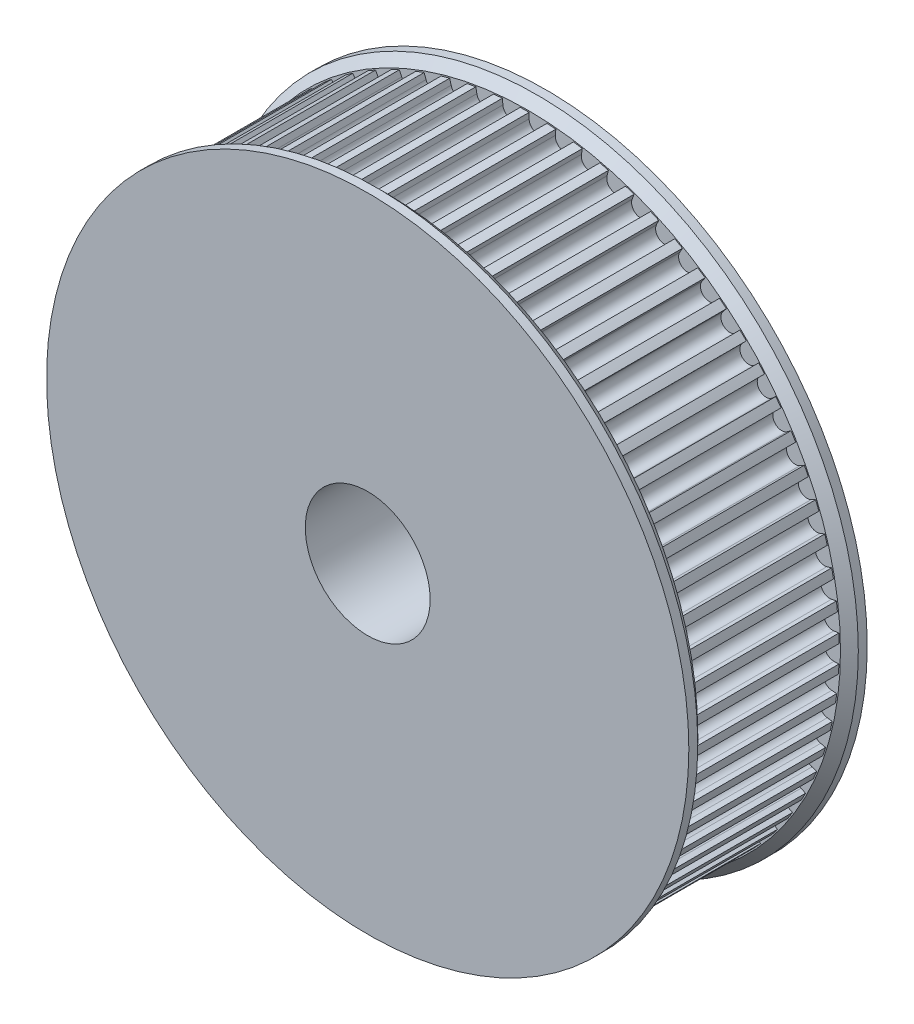
from build123d import *

# Parameters (mm, degrees)
SKETCH1_R           = 18
BOSS_EXTRUDE1_DEPTH = 20
SKETCH2_R           = 7
CUT_EXTRUDE1_DEPTH  = 60
SKETCH4_R           = 34.85
SKETCH4_R_2         = 14.576002813
BOSS_EXTRUDE2_DEPTH = 17
CUT_EXTRUDE3_DEPTH  = 18
CIRPATTERN1_COUNT   = 73
BOSS_EXTRUDE3_START = 2
SKETCH7_R           = 36
SKETCH7_R_2         = 7
BOSS_EXTRUDE3_DEPTH = 2
LPATTERN1_COUNT     = 2
LPATTERN1_PITCH     = 18
CHAMFER1_SIZE       = 1
SKETCH5_R           = 2.802886509
CUT_EXTRUDE2_DEPTH  = 4


with BuildPart() as part:
    # Sketch1 → Boss-Extrude1 (new body)
    with BuildSketch(Plane.XY):
        Circle(SKETCH1_R)
    extrude(amount=BOSS_EXTRUDE1_DEPTH)

    # Sketch2 → Cut-Extrude1 (cut)
    with BuildSketch(Plane.XY.offset(20)):
        Circle(SKETCH2_R)
    extrude(amount=-CUT_EXTRUDE1_DEPTH, mode=Mode.SUBTRACT)

    # Sketch4 → Boss-Extrude2 (add)
    with BuildSketch(Plane.XY.offset(20)):
        Circle(SKETCH4_R)
        Circle(SKETCH4_R_2, mode=Mode.SUBTRACT)
    extrude(amount=-BOSS_EXTRUDE2_DEPTH)

    # Sketch6 → Cut-Extrude3 (cut)
    with BuildSketch(Plane.XY.offset(20)):
        with BuildLine():
            Line((2.095100681, 35.489561228), (2.095100681, 34.226509354))
            ThreePointArc((2.095100681, 34.226509354), (1.095100681, 33.226509354), (0.095100681, 34.226509354))
            Line((0.095100681, 34.226509354), (0.095100681, 35.489561228))
            ThreePointArc((0.095100681, 35.489561228), (1.095100681, 36.489561228), (2.095100681, 35.489561228))
        make_face()
    cut_extrude3 = extrude(amount=-CUT_EXTRUDE3_DEPTH, mode=Mode.SUBTRACT)

    # CirPattern1: Cut-Extrude3 ×73 about axis
    cirpattern1_axis = Axis((0, 0, 20), (0, 0, 1))
    for i in range(1, CIRPATTERN1_COUNT):
        add(cut_extrude3.rotate(cirpattern1_axis, i * 360 / CIRPATTERN1_COUNT), mode=Mode.SUBTRACT)

    # Sketch7 → Boss-Extrude3 (add)
    with BuildSketch(Plane.XY.offset(20).offset(BOSS_EXTRUDE3_START)):
        Circle(SKETCH7_R)
        Circle(SKETCH7_R_2, mode=Mode.SUBTRACT)
    boss_extrude3 = extrude(amount=-BOSS_EXTRUDE3_DEPTH)

    # LPattern1: Boss-Extrude3 ×2
    with Locations(*[(0, 0, -i * LPATTERN1_PITCH) for i in range(1, LPATTERN1_COUNT)]):
        add(boss_extrude3)

    # Chamfer1
    chamfer1_edges = [part.edges().sort_by_distance(p)[0] for p in [
        (-36, 0, 20),
        (-36, 0, 4),
    ]]
    chamfer(chamfer1_edges, length=CHAMFER1_SIZE)

    # Sketch5 → Cut-Extrude2 (cut)
    with BuildSketch(Plane.XY.offset(20)):
        with Locations((0.724287197, 29.141908403)):
            Circle(SKETCH5_R)
    extrude(amount=-CUT_EXTRUDE2_DEPTH, mode=Mode.SUBTRACT)


solid = part.part
